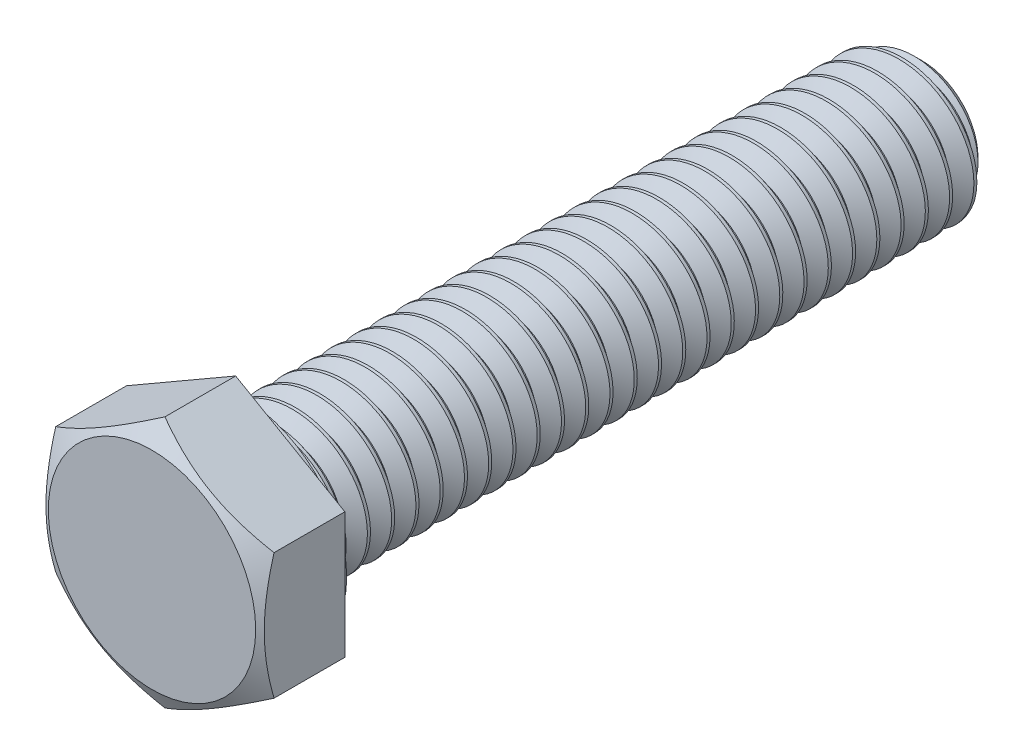
from build123d import *

# Parameters (mm, degrees)
SKETCH4_OUTSIDE_W  = 29.606
SKETCH4_OUTSIDE_H  = 29.606
CUT_EXTRUDE1_DEPTH = 52.735514371
CUT_SWEEP1_PITCH   = 1.5875
CUT_SWEEP1_TO      = 44.45


with BuildPart() as part:
    # Sketch3 → Revolve1 (revolve)
    with BuildSketch(Plane(origin=(0, 0, 0), x_dir=(0, 0, -1), z_dir=(1, 0, 0)), mode=Mode.PRIVATE) as revolve1_sk:
        Polygon((-25.2015625, 0), (-25.2015625, 6.7865625), (-24.357286186, 8.248891971), (-19.7246875, 8.248891971), (-19.7246875, 6.7865625), (-19.2484375, 6.7865625), (-19.2484375, 4.7625), (24.0903125, 4.7625), (25.2015625, 3.65125), (25.2015625, 0), align=None)
    revolve(revolve1_sk.sketch.rotate(Axis((0, 0, 25.2015625), (0, 0, -1)), 90), axis=Axis((0, 0, 25.2015625), (0, 0, -1)))

    # Sketch4 outside → Cut-Extrude1 (cut, through all)
    with BuildSketch(Plane.XY.offset(25.2015625)):
        Rectangle(SKETCH4_OUTSIDE_W, SKETCH4_OUTSIDE_H)
        Polygon((7.14375, 4.124445986), (0, 8.248891971), (-7.14375, 4.124445986), (-7.14375, -4.124445986), (0, -8.248891971), (7.14375, -4.124445986), align=None, mode=Mode.SUBTRACT)
    extrude(amount=-CUT_EXTRUDE1_DEPTH, mode=Mode.SUBTRACT)


with BuildPart() as body_2:
    # Split1: the piece on the far side of the plane
    add(part.part)
    split(bisect_by=Plane(origin=(0, 0, 19.2484375), x_dir=(-1, 0, 0), z_dir=(0, 0, -1)), keep=Keep.BOTTOM)


with BuildPart() as part_1:
    add(part.part)

    # Split1
    split(bisect_by=Plane(origin=(0, 0, 19.2484375), x_dir=(-1, 0, 0), z_dir=(0, 0, -1)), keep=Keep.TOP)

    # Cut-Sweep1: arcs per turn and ends read off the stored shape
    # Cut-Sweep1: the profile of Sketch7 screwed along a right-hand helix through 29 turns, 8 arcs to a turn; built about Z, then put on its axis
    cut_sweep1_z = Axis((0, 0, 0), (0, 0, 1))
    cut_sweep1_corners = [(3.731388504, 0, -0.5953125), (3.731388504, 0, -0.79375), (4.848425958, 0, -1.438671875), (4.848425958, 0, 0.049609375)]
    with BuildLine(mode=Mode.PRIVATE) as cut_sweep1_profile:
        Line(cut_sweep1_corners[0], cut_sweep1_corners[1])
        Line(cut_sweep1_corners[1], cut_sweep1_corners[2])
        Line(cut_sweep1_corners[2], cut_sweep1_corners[3])
        Line(cut_sweep1_corners[3], cut_sweep1_corners[0])
    cut_sweep1_cap = Face(cut_sweep1_profile.wire())
    cut_sweep1_turn_angles = [0, 22.5, 45, 67.5, 90, 112.5, 135, 157.5, 180, 202.5, 225, 247.5, 270, 292.5, 315, 337.5, 360]
    cut_sweep1_turn_weights = [1, 0.9238795325112867, 1, 0.9238795325112867, 1, 0.9238795325112867, 1, 0.9238795325112867, 1, 0.9238795325112867, 1, 0.9238795325112867, 1, 0.9238795325112867, 1, 0.9238795325112867, 1]
    cut_sweep1_turn_rails = [Edge.make_bspline([Vector(p[0], p[1], 0).rotate(cut_sweep1_z, cut_sweep1_turn_angles[k]) / cut_sweep1_turn_weights[k] + Vector(0, 0, p[2] + CUT_SWEEP1_PITCH * cut_sweep1_turn_angles[k] / 360) for k in range(17)], [0, 0, 0, 1, 1, 2, 2, 3, 3, 4, 4, 5, 5, 6, 6, 7, 7, 8, 8, 8], 2, cut_sweep1_turn_weights) for p in cut_sweep1_corners]
    cut_sweep1_turn_sides = [Face.make_surface_from_curves(cut_sweep1_turn_rails[p[0]], cut_sweep1_turn_rails[p[1]]) for p in [(0, 1), (1, 2), (2, 3), (3, 0)]]
    cut_sweep1 = Plane(origin=(0, 0, -25.2015625), x_dir=(0, 1, 0), z_dir=(0, 0, 1)) * split(Solid(Shell([*[p.moved(Location((0, 0, CUT_SWEEP1_PITCH * i))) for i in range(29) for p in cut_sweep1_turn_sides], cut_sweep1_cap, cut_sweep1_cap.rotate(cut_sweep1_z, 10440).moved(Location((0, 0, CUT_SWEEP1_PITCH * 10440 / 360)))])), bisect_by=Plane.XY.offset(CUT_SWEEP1_TO), keep=Keep.BOTTOM, mode=Mode.PRIVATE)
    add(cut_sweep1, mode=Mode.SUBTRACT)

    add(body_2.part)  # Boss-Extrude2 merges body 2
    # Boss-Extrude2 cone 1 section (through the dimple's axis) → Boss-Extrude2 (revolve)
    with BuildSketch(Plane(origin=(0, 0, 19.2484375), x_dir=(0, -1, 0), z_dir=(1, 0, 0))):
        Polygon((0, 0), (4.7625, 0), (0, 8.248891971), align=None)
    revolve(axis=Axis((0, 0, 19.2484375), (0, 0, -1)))


solid = part_1.part
